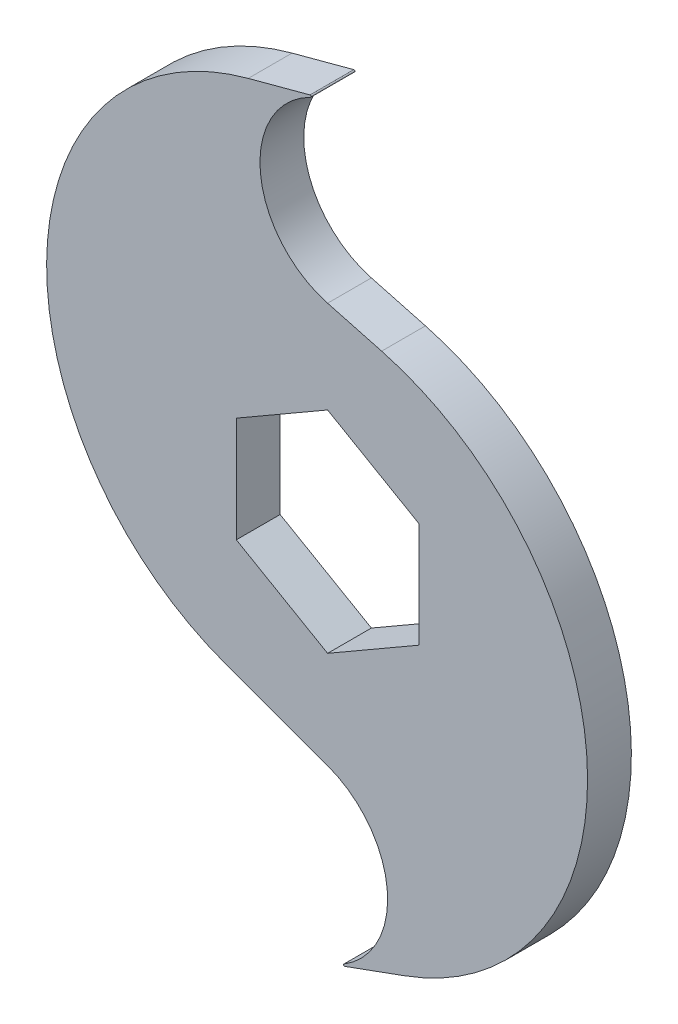
from build123d import *

# Parameters (mm, degrees)
BOSS_EXTRUDE1_DEPTH = 3.048
FILLET1_R           = 0.127


with BuildPart() as part:
    # Sketch1 → Boss-Extrude1 (new, symmetric)
    with BuildSketch(Plane.XY):
        with BuildLine():
            Line((0, 52.07), (-11.040532194, 49.111698314))
            ThreePointArc((-11.040532194, 49.111698314), (-39.066320922, 14.192289272), (-14.190605813, -23.03684931))
            Line((-14.190605813, -23.03684931), (0, -28.201807432))
            ThreePointArc((0, -28.201807432), (8.35634418, -40.135903716), (0, -52.07))
            Line((0, -52.07), (10.740686656, -48.160709762))
            ThreePointArc((10.740686656, -48.160709762), (36.144496882, -10.141220984), (7.52373904, 25.519504212))
            Line((7.52373904, 25.519504212), (0, 27.535484012))
            ThreePointArc((0, 27.535484012), (-9.412998127, 39.802742006), (0, 52.07))
        make_face()
        Polygon((0, 14.664696837), (-12.7, 7.332348419), (-12.7, -7.332348419), (0, -14.664696837), (12.7, -7.332348419), (12.7, 7.332348419), align=None, mode=Mode.SUBTRACT)
    extrude(amount=BOSS_EXTRUDE1_DEPTH, both=True)

    # Fillet1
    fillet1_edges = [part.edges().sort_by_distance(p)[0] for p in [
        (0, 52.07, 0),
        (0, -52.07, 0),
    ]]
    fillet(fillet1_edges, radius=FILLET1_R)


solid = part.part
